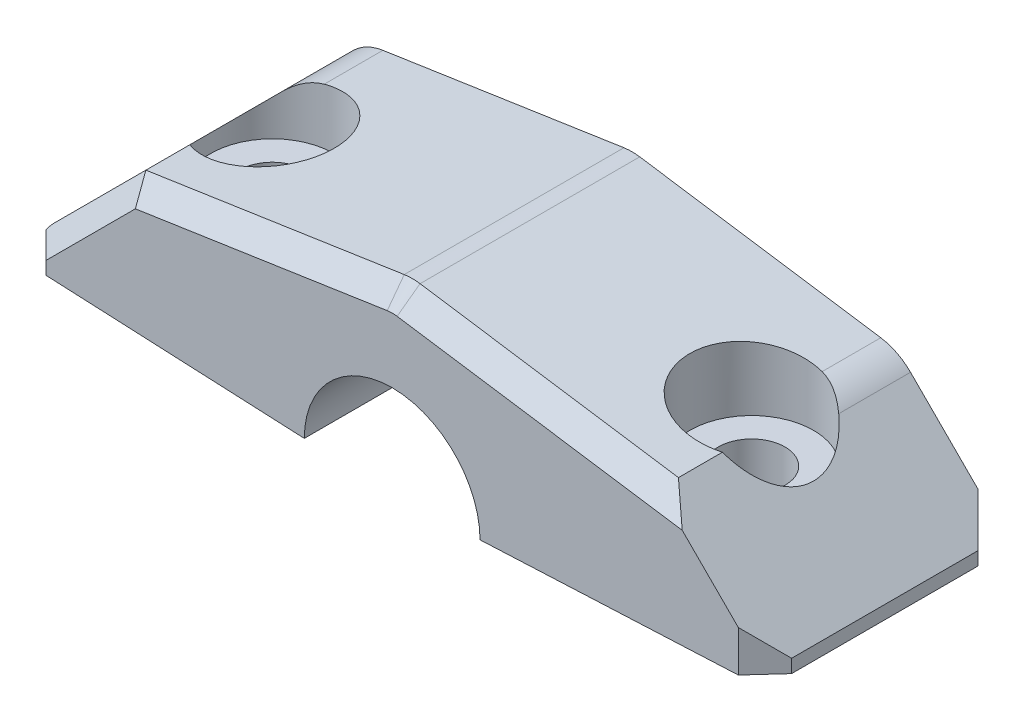
from build123d import *

# Parameters (mm, degrees)
BOSS_EXTRUDE1_DEPTH     = 9
CUT_EXTRUDE1_DEPTH      = 18.867568385
CUT_EXTRUDE1_DEPTH_BACK = 18.867568385
CHAMFER1_SIZE           = 1
SKETCH4_R               = 1.25
CUT_EXTRUDE2_DEPTH      = 18.867568385
CUT_EXTRUDE3_START      = 3
SKETCH5_R               = 2.325
CUT_EXTRUDE3_DEPTH      = 10
FILLET2_R               = 2
CHAMFER3_SIZE           = 0.75


with BuildPart() as part:
    # Sketch1 → Boss-Extrude1 (new body)
    with BuildSketch(Plane.XY):
        with BuildLine():
            Line((-14, 0.5), (-14, 6.5))
            Line((-14, 6.5), (14, 6.5))
            Line((14, 6.5), (14, 0.5))
            Line((14, 0.5), (3.3, 0))
            ThreePointArc((3.3, 0), (0, 3.3), (-3.3, 0))
            Line((-3.3, 0), (-14, 0.5))
        make_face()
    extrude(amount=BOSS_EXTRUDE1_DEPTH)

    # Sketch2 → Cut-Extrude1 (cut, two sides: drawn at the far end of the back side and taken through both)
    with BuildSketch(Plane.XY.offset(9).offset(-CUT_EXTRUDE1_DEPTH_BACK)):
        Polygon((-10, 5), (0, 6.5), (-14, 6.5), (-14, 1), align=None)
        Polygon((14, 6.5), (0, 6.5), (10, 5), (14, 1), align=None)
    extrude(amount=CUT_EXTRUDE1_DEPTH + CUT_EXTRUDE1_DEPTH_BACK, mode=Mode.SUBTRACT)

    # Chamfer1
    chamfer1_edges = [part.edges().sort_by_distance(p)[0] for p in [
        (14, 0.75, 9),
        (-14, 0.75, 0),
        (-14, 0.75, 9),
        (14, 0.75, 0),
    ]]
    chamfer(chamfer1_edges, length=CHAMFER1_SIZE)

    # Sketch4 → Cut-Extrude2 (cut, through all)
    with BuildSketch(Plane(origin=(0, 0, 0), x_dir=(-1, 0, 0), z_dir=(0, 1, 0))):
        with Locations(Location((-9, 4.5, 0), (0, 0, 216.869897646))):
            Circle(SKETCH4_R)
        with Locations(Location((9, 4.5, 0), (0, 0, 323.130102354))):
            Circle(SKETCH4_R)
    extrude(amount=CUT_EXTRUDE2_DEPTH, mode=Mode.SUBTRACT)

    # Sketch5 → Cut-Extrude3 (cut)
    with BuildSketch(Plane(origin=(0, 0, 0), x_dir=(1, 0, 0), z_dir=(0, 1, 0)).offset(CUT_EXTRUDE3_START)):
        with Locations(Location((9, -4.5, 0), (0, 0, 64.525615739))):
            Circle(SKETCH5_R)
        with Locations(Location((-9, -4.5, 0), (0, 0, 115.474384261))):
            Circle(SKETCH5_R)
    extrude(amount=CUT_EXTRUDE3_DEPTH, mode=Mode.SUBTRACT)

    # Fillet2
    # the kernel refuses this fillet: 2 mm, written as the material it takes off along each edge
    with BuildSketch(Plane(origin=(10, 5, -1.647264498), x_dir=(0.7071067811865476, -0.7071067811865476, 0), z_dir=(0, 0, 1)), Plane(origin=(-10, 5, 4.048306423), x_dir=(-0.7071067811865476, -0.7071067811865476, 0), z_dir=(0, 0, -1))) as fillet2_piece_1:
        with BuildLine():
            CenterArc((FILLET2_R * 0.329452899538, -FILLET2_R), FILLET2_R, 90, 36.46923439)
            Line((-FILLET2_R * 0.264938161546, -FILLET2_R * 0.195823858534), (-FILLET2_R * 0.276825982767, -FILLET2_R * 0.179740335704))
            Line((-FILLET2_R * 0.276825982767, -FILLET2_R * 0.179740335704), (-FILLET2_R * 0.00658905799077, FILLET2_R * 0.02))
            Line((-FILLET2_R * 0.00658905799077, FILLET2_R * 0.02), (FILLET2_R * 0.329452899538, FILLET2_R * 0.02))
            Line((FILLET2_R * 0.329452899538, FILLET2_R * 0.02), (FILLET2_R * 0.329452899538, 0))
        make_face()
    extrude(amount=5.695570921, mode=Mode.SUBTRACT)
    with BuildSketch(Plane(origin=(0, 6.5, 9.75), x_dir=(0.9889363528682978, -0.1483404529302431, 0), z_dir=(0, 0, -1))) as fillet2_piece_2:
        with BuildLine():
            CenterArc((FILLET2_R * 0.15, FILLET2_R), FILLET2_R, 252.93846878, 17.06153122)
            Line((-FILLET2_R * 0.143398533007, FILLET2_R * 0.0440097799511), (-FILLET2_R * 0.149266503667, FILLET2_R * 0.0248899755501))
            Line((-FILLET2_R * 0.149266503667, FILLET2_R * 0.0248899755501), (-FILLET2_R * 0.003, -FILLET2_R * 0.02))
            Line((-FILLET2_R * 0.003, -FILLET2_R * 0.02), (FILLET2_R * 0.15, -FILLET2_R * 0.02))
            Line((FILLET2_R * 0.15, -FILLET2_R * 0.02), (FILLET2_R * 0.15, 0))
        make_face()
    extrude(amount=10.5, mode=Mode.SUBTRACT)
    with BuildSketch(Plane(origin=(-14, 1, -0.95470504), x_dir=(0, -1, 0), z_dir=(0, 0, 1))) as fillet2_piece_3:
        with BuildLine():
            CenterArc((0.861339487, 1.967087638), FILLET2_R, 225, 34.591227114)
            Line((-0.552874076, 0.552874076), (-0.581158347, 0.524589804))
            Line((-0.581158347, 0.524589804), (-0.028284271, -0.028284271))
            Line((-0.028284271, -0.028284271), (0, -0.04))
            ThreePointArc((0, -0.04), (0.25, -0.04), (0.49277321, -0.039341753))
            Line((0.49277321, -0.039341753), (0.5, 0))
        make_face()
    extrude(amount=10.90941008, mode=Mode.SUBTRACT)

    # Chamfer3
    # the kernel refuses this chamfer: 0.75 mm, written as the material it takes off along each edge
    with BuildSketch(Plane(origin=(-14.36384086, 0.63615914, 9), x_dir=(0.7068394360706732, -0.7068394360706737, 0.027495876610586747), z_dir=(0.7071067811865477, 0.7071067811865474, 0))) as chamfer3_piece_1:
        Polygon((CHAMFER3_SIZE * 0.999621916911, CHAMFER3_SIZE * 0.0274958766106), (-CHAMFER3_SIZE * 0.0274958766106, CHAMFER3_SIZE * 0.999621916911), (0, 0), align=None)
    extrude(amount=8.100165169, mode=Mode.SUBTRACT)
    with BuildSketch(Plane(origin=(-11.907423096, 4.713886536, 9), x_dir=(0.1482843679136212, -0.988562452757474, 0.027495876610586778), z_dir=(0.9889363528682975, 0.14834045293024473, 0)), Plane(origin=(0.296680906, 6.455497864, 9), x_dir=(-0.14828436791362096, -0.9885624527574741, 0.02749587661058676), z_dir=(0.9889363528682976, -0.14834045293024448, 0))) as chamfer3_piece_2:
        Polygon((CHAMFER3_SIZE * 0.999621916911, CHAMFER3_SIZE * 0.0274958766106), (-CHAMFER3_SIZE * 0.0274958766106, CHAMFER3_SIZE * 0.999621916911), (0, 0), align=None)
    extrude(amount=11.740636449, mode=Mode.SUBTRACT)
    with BuildSketch(Plane(origin=(0, 4.477625158, 9), x_dir=(0.1483404529300489, 0.9889363528683269, 0), z_dir=(0.9889363528683269, -0.1483404529300489, 0))) as chamfer3_piece_3:
        Polygon((2 - CHAMFER3_SIZE, 0), (2, -CHAMFER3_SIZE), (2, 0), align=None)
    revolve(axis=Axis((0, 4.477625158, 9), (0, 0, 1)), revolution_arc=17.06153122, mode=Mode.SUBTRACT)


solid = part.part
